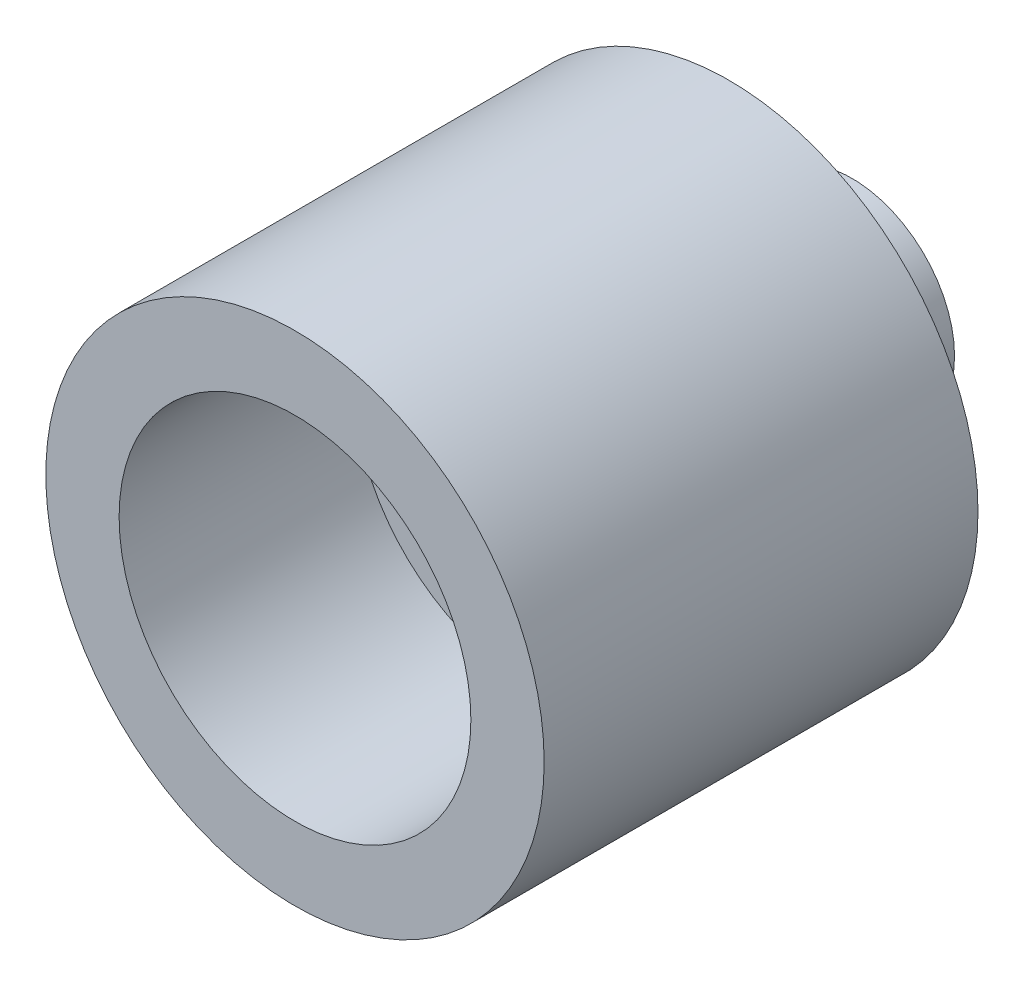
from build123d import *

# Parameters (mm, degrees)
SKETCH1_R                = 17.5
BOSS_EXTRUDE1_DEPTH      = 50
SKETCH2_R                = 10.732305205
CUT_EXTRUDE1_DEPTH       = 2.45
BOSS_EXTRUDE2_DEPTH      = 45
BOSS_EXTRUDE2_DEPTH_BACK = 29
SKETCH4_R                = 42.5
CUT_EXTRUDE2_DEPTH       = 113.41663578
CUT_EXTRUDE2_DEPTH_BACK  = 113.41663578
SKETCH3_R                = 4.335
SKETCH5_R                = 30
CUT_EXTRUDE3_DEPTH       = 40


with BuildPart() as part:
    # Sketch1 → Boss-Extrude1 (new body)
    with BuildSketch(Plane.XY):
        Circle(SKETCH1_R)
    extrude(amount=BOSS_EXTRUDE1_DEPTH)

    # Sketch2 → Cut-Extrude1 (cut)
    with BuildSketch(Plane(origin=(0, 0, 0), x_dir=(-1, 0, 0), z_dir=(0, 0, -1))):
        Circle(SKETCH2_R)
    extrude(amount=-CUT_EXTRUDE1_DEPTH, mode=Mode.SUBTRACT)

    # Sketch4 → Boss-Extrude2 (add, two sides: drawn at the far end of the back side and taken through both)
    with BuildSketch(Plane.XY.offset(50).offset(-BOSS_EXTRUDE2_DEPTH_BACK)):
        Circle(SKETCH4_R)
    extrude(amount=BOSS_EXTRUDE2_DEPTH + BOSS_EXTRUDE2_DEPTH_BACK)

    # Sketch3 → Cut-Extrude2 (cut, two sides: drawn at the far end of the back side and taken through both)
    with BuildSketch(Plane(origin=(0, 0, 0), x_dir=(-1, 0, 0), z_dir=(0, 0, -1)).offset(-CUT_EXTRUDE2_DEPTH_BACK)):
        Circle(SKETCH3_R)
    extrude(amount=CUT_EXTRUDE2_DEPTH + CUT_EXTRUDE2_DEPTH_BACK, mode=Mode.SUBTRACT)

    # Sketch5 → Cut-Extrude3 (cut)
    with BuildSketch(Plane.XY.offset(95)):
        Circle(SKETCH5_R)
    extrude(amount=-CUT_EXTRUDE3_DEPTH, mode=Mode.SUBTRACT)


solid = part.part
